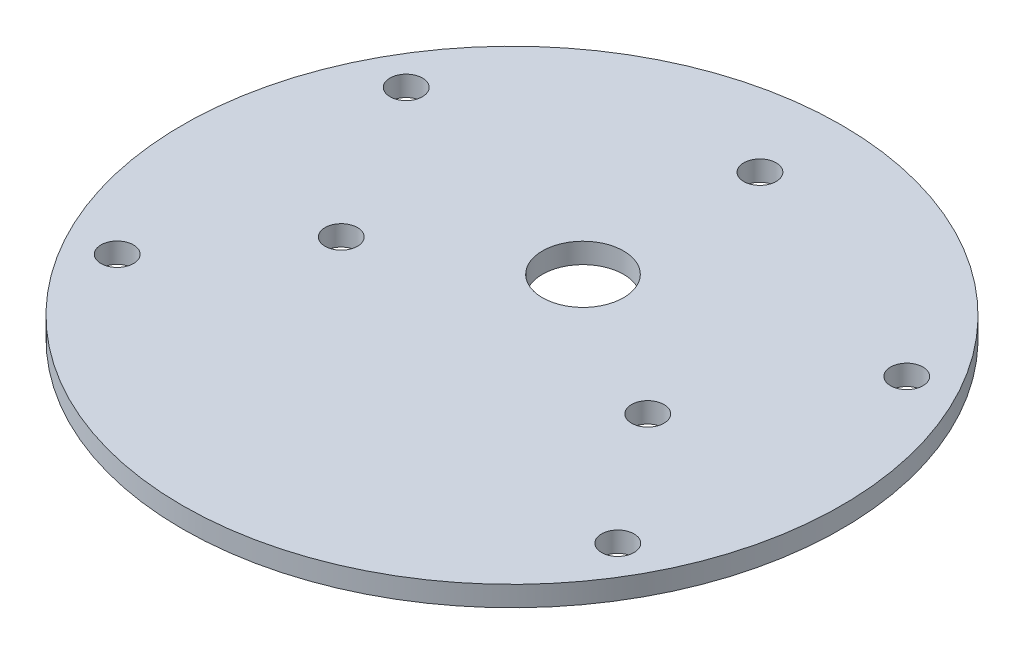
from build123d import *

# Parameters (mm, degrees)
SKETCH_1_R      = 32.5
SKETCH_1_R_2    = 1.6
SKETCH_1_R_3    = 4
EXTRUDE_1_DEPTH = 2


with BuildPart() as part:
    # 草图1 → 凸台-拉伸1 (new body)
    with BuildSketch(Plane(origin=(0, 0, 0), x_dir=(1, 0, 0), z_dir=(0, 1, 0))):
        Circle(SKETCH_1_R)
        with Locations((24.681724008, 14.25)):
            Circle(SKETCH_1_R_2, mode=Mode.SUBTRACT)
        with Locations((0, 7)):
            Circle(SKETCH_1_R_3, mode=Mode.SUBTRACT)
        with Locations((-24.681724008, 14.25)):
            Circle(SKETCH_1_R_2, mode=Mode.SUBTRACT)
        with Locations((24.681724008, -14.25)):
            Circle(SKETCH_1_R_2, mode=Mode.SUBTRACT)
        with Locations((0, 24.45)):
            Circle(SKETCH_1_R_2, mode=Mode.SUBTRACT)
        with Locations((15.112143296, -1.725)):
            Circle(SKETCH_1_R_2, mode=Mode.SUBTRACT)
        with Locations((-15.112143296, -1.725)):
            Circle(SKETCH_1_R_2, mode=Mode.SUBTRACT)
        with Locations((-24.681724008, -14.25)):
            Circle(SKETCH_1_R_2, mode=Mode.SUBTRACT)
    extrude(amount=EXTRUDE_1_DEPTH)


solid = part.part
